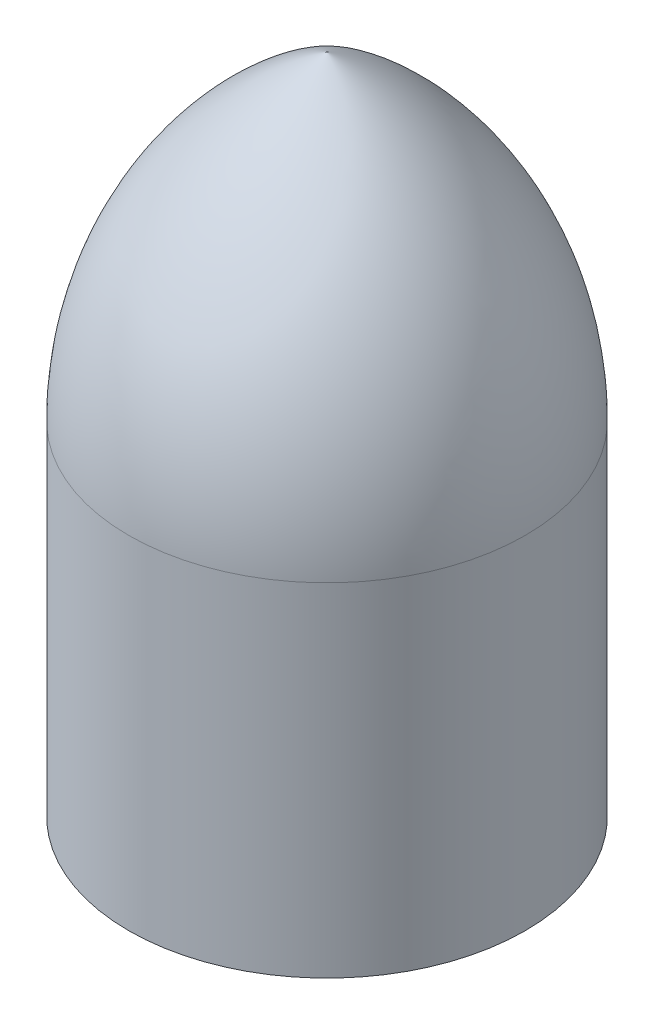
from build123d import *

# Parameters (mm, degrees)
SKETCH2_W                       = 5
SKETCH2_H                       = 3.2
CUT_EXTRUDE1_DEPTH              = 60
SKETCH3_W                       = 2
SKETCH3_H                       = 3
BOSS_EXTRUDE1_DEPTH             = 60
FILLET1_R                       = 2
MIRROR4_START                   = -60
MIRROR4_DEPTH                   = 60
MIRROR6_START                   = -60
MIRROR6_DEPTH                   = 60
BOSS_EXTRUDE2_START             = -4
BOSS_EXTRUDE2_DEPTH             = 4
FILLET3_R                       = 3
SKETCH7_R                       = 1
CUT_EXTRUDE2_DEPTH              = 4
CIRPATTERN1_COUNT               = 2
CIRPATTERN1_ANGLE               = 20
CIRPATTERN1_THE_OTHER_WAY_COUNT = 2
CIRPATTERN1_THE_OTHER_WAY_ANGLE = 20


# Read off the part's stored shape, not the designer's step: Mirror4, Mirror6
# Some blends are built 0.0001 mm under size
with BuildPart() as part:
    # Sketch1 → Revolve2 (revolve)
    with BuildSketch(Plane.XY, mode=Mode.PRIVATE) as revolve2_sk:
        with BuildLine():
            Line((-31.75, 0), (-31.75, -60))
            Line((-31.75, -60), (-34.75, -60))
            Line((-34.75, -60), (-34.75, 0))
            ThreePointArc((-34.75, 0), (-25.356578604, 32.95285458), (0, 56))
            Line((0, 56), (0, 50))
            ThreePointArc((0, 50), (-23.141849761, 29.614449598), (-31.75, 0))
        make_face()
    revolve(revolve2_sk.sketch.rotate(Axis((0, 68.663273936, 0), (0, -1, 0)), 270), axis=Axis((0, 68.663273936, 0), (0, -1, 0)))

    # Sketch2 → Cut-Extrude1 (cut)
    with BuildSketch(Plane.XZ.offset(60)):
        with Locations((-30.25, 0)):
            Rectangle(SKETCH2_W, SKETCH2_H)
    cut_extrude1 = extrude(amount=-CUT_EXTRUDE1_DEPTH, mode=Mode.SUBTRACT)

    # Mirror1: Cut-Extrude1 across plane
    add(cut_extrude1.mirror(Plane(origin=(0, 0, 0), x_dir=(0, 0, 1), z_dir=(1, 0, 0))), mode=Mode.SUBTRACT)

    # Sketch3 → Boss-Extrude1 (add)
    with BuildSketch(Plane.XZ.offset(60)):
        with Locations((-30.709659412, 3.1)):
            Rectangle(SKETCH3_W, SKETCH3_H)
    extrude(amount=-BOSS_EXTRUDE1_DEPTH)

    # Fillet1
    # the kernel refuses this fillet: 2 mm, written as the material it takes off along each edge
    with BuildSketch(Plane(origin=(-29.709659412, -64.945438814, 4.6), x_dir=(0, 0, -1), z_dir=(0, 1, 0))) as fillet1_piece_1:
        with BuildLine():
            CenterArc((1.978175526, 2), FILLET1_R, 188.47208389, 81.52791611)
            Line((0, 1.705344965), (0, 0))
            Line((0, 0), (1.978175526, 0))
        make_face()
    extrude(amount=64.945438814, mode=Mode.SUBTRACT)

    # Mirror4 outline → Mirror4 (add)
    with BuildSketch(Plane(origin=(0, 0, 0), x_dir=(1, 0, 0), z_dir=(0, 1, 0)).offset(MIRROR4_START)):
        with BuildLine():
            Line((-31.709659412, 1.6), (-29.709659412, 1.6))
            Line((-29.709659412, 1.6), (-29.709659412, 2.621824474))
            ThreePointArc((-29.709659412, 2.621824474), (-30.194847531, 3.927713047), (-31.415004377, 4.6))
            ThreePointArc((-31.415004377, 4.6), (-31.597955545, 3.103498896), (-31.709659412, 1.6))
        make_face()
    extrude(amount=MIRROR4_DEPTH)

    # Mirror6 outline → Mirror6 (add)
    with BuildSketch(Plane(origin=(0, 0, 0), x_dir=(1, 0, 0), z_dir=(0, 1, 0)).offset(MIRROR6_START)):
        with BuildLine():
            ThreePointArc((31.415004377, -4.6), (31.597955545, -3.103498896), (31.709659412, -1.6))
            Line((31.709659412, -1.6), (29.709659412, -1.6))
            Line((29.709659412, -1.6), (29.709659412, -2.621824474))
            ThreePointArc((29.709659412, -2.621824474), (30.194847531, -3.927713047), (31.415004377, -4.6))
        make_face()
        with BuildLine():
            Line((29.709659412, 2.621824474), (29.709659412, 1.6))
            Line((29.709659412, 1.6), (31.709659412, 1.6))
            ThreePointArc((31.709659412, 1.6), (31.597955545, 3.103498896), (31.415004377, 4.6))
            ThreePointArc((31.415004377, 4.6), (30.194847531, 3.927713047), (29.709659412, 2.621824474))
        make_face()
    extrude(amount=MIRROR6_DEPTH)

    # Sketch6 → Boss-Extrude2 (add)
    with BuildSketch(Plane.XZ.offset(60).offset(BOSS_EXTRUDE2_START)):
        with BuildLine():
            Line((-18.207999616, 18.207999616), (-24.571960646, 24.571960646))
            ThreePointArc((-24.571960646, 24.571960646), (0, 34.75), (24.571960646, 24.571960646))
            Line((24.571960646, 24.571960646), (18.207999616, 18.207999616))
            ThreePointArc((18.207999616, 18.207999616), (0, 25.75), (-18.207999616, 18.207999616))
        make_face()
        with BuildLine():
            Line((-18.207999616, -18.207999616), (-24.571960646, -24.571960646))
            ThreePointArc((-24.571960646, -24.571960646), (0, -34.75), (24.571960646, -24.571960646))
            Line((24.571960646, -24.571960646), (18.207999616, -18.207999616))
            ThreePointArc((18.207999616, -18.207999616), (0, -25.75), (-18.207999616, -18.207999616))
        make_face()
    extrude(amount=BOSS_EXTRUDE2_DEPTH)

    # Fillet3
    fillet3_edges = [part.edges().sort_by_distance(p)[0] for p in [
        (-22.450640303, -58, 22.450640303),
        (22.450640303, -58, 22.450640303),
        (22.450640303, -58, -22.450640303),
        (-22.450640303, -58, -22.450640303),
        (-18.207999616, -58, -18.207999616),
        (18.207999616, -58, -18.207999616),
        (18.207999616, -58, 18.207999616),
        (-18.207999616, -58, 18.207999616),
    ]]
    fillet(fillet3_edges, radius=FILLET3_R - 0.0001)  # a hair under: the kernel refuses the full size

    # Sketch7 → Cut-Extrude2 (cut)
    with BuildSketch(Plane.XZ.offset(60)):
        with Locations(Location((0, -28, 0), (0, 0, 270))):
            Circle(SKETCH7_R)
        with Locations(Location((0, 28, 0), (0, 0, 270))):
            Circle(SKETCH7_R)
    cut_extrude2 = extrude(amount=-CUT_EXTRUDE2_DEPTH, mode=Mode.SUBTRACT)

    # CirPattern1: Cut-Extrude2 ×2 about axis
    cirpattern1_axis = Axis((0, 0, 0), (0, 1, 0))
    for i in range(1, CIRPATTERN1_COUNT):
        add(cut_extrude2.rotate(cirpattern1_axis, i * CIRPATTERN1_ANGLE / (CIRPATTERN1_COUNT - 1)), mode=Mode.SUBTRACT)

    # CirPattern1 the other way: Cut-Extrude2 ×2 about axis
    cirpattern1_the_other_way_axis = Axis((0, 0, 0), (0, -1, 0))
    for i in range(1, CIRPATTERN1_THE_OTHER_WAY_COUNT):
        add(cut_extrude2.rotate(cirpattern1_the_other_way_axis, i * CIRPATTERN1_THE_OTHER_WAY_ANGLE / (CIRPATTERN1_THE_OTHER_WAY_COUNT - 1)), mode=Mode.SUBTRACT)


solid = part.part
